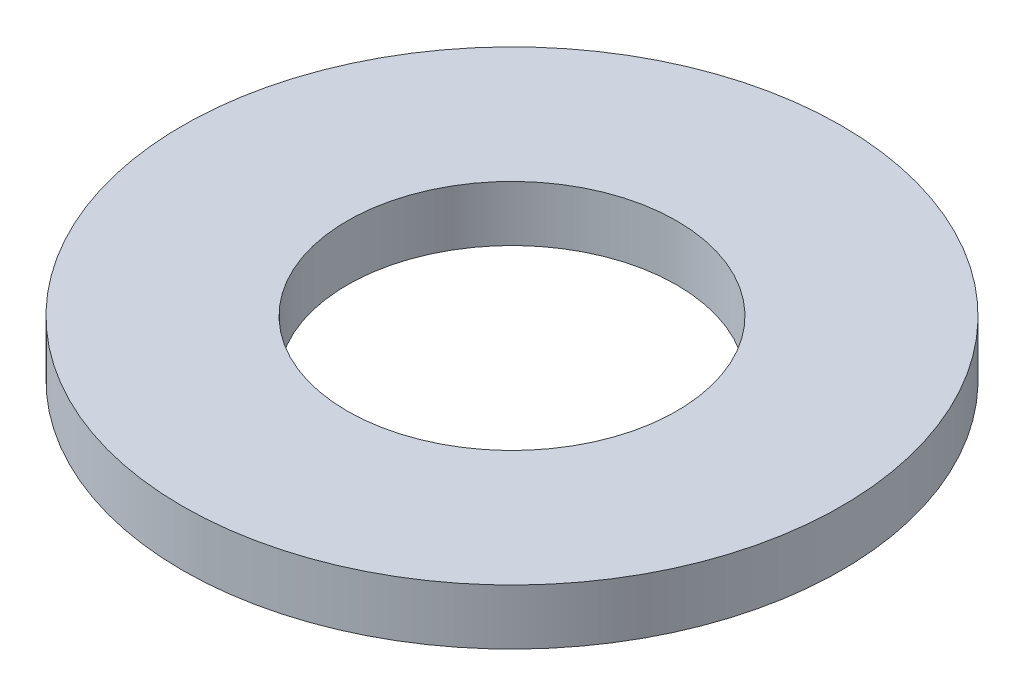
from build123d import *

# Parameters (mm, degrees)
SKETCH1_R           = 95
BOSS_EXTRUDE1_DEPTH = 16
SKETCH2_R           = 47.5
CUT_EXTRUDE1_DEPTH  = 136.299667405


with BuildPart() as part:
    # Sketch1 → Boss-Extrude1 (new body)
    with BuildSketch(Plane(origin=(0, 0, 0), x_dir=(1, 0, 0), z_dir=(0, 1, 0))):
        Circle(SKETCH1_R)
    extrude(amount=BOSS_EXTRUDE1_DEPTH)

    # Sketch2 → Cut-Extrude1 (cut, through all)
    with BuildSketch(Plane(origin=(0, 0, 0), x_dir=(1, 0, 0), z_dir=(0, 1, 0))):
        Circle(SKETCH2_R)
    extrude(amount=CUT_EXTRUDE1_DEPTH, mode=Mode.SUBTRACT)


solid = part.part
